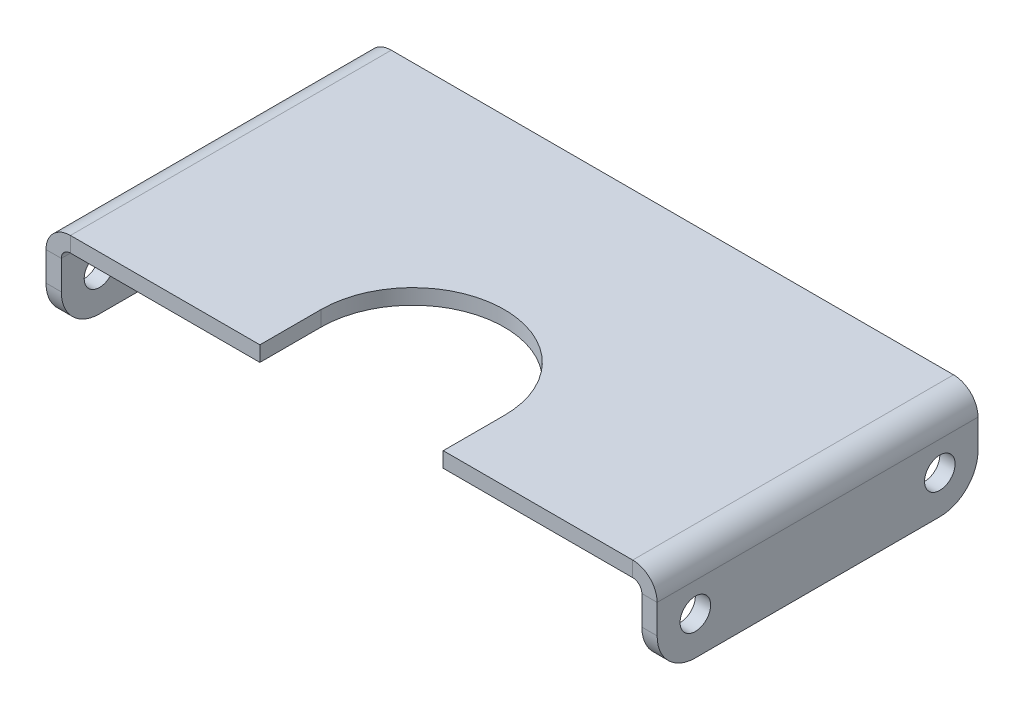
from build123d import *
from build123d.topology import SkipClean

# Parameters (mm, degrees)
EXTRUDE_THIN1_DEPTH        = 133.35
CUT_EXTRUDE1_DEPTH         = 189.050079766
SKETCH3_R                  = 6.35
CUT_EXTRUDE2_DEPTH         = 290.395633174
FILLET1_R                  = 15.875
CONVERT_SOLID1_START       = -123.9798384
CONVERT_SOLID1_OUTLINE_W   = 3.81
CONVERT_SOLID1_OUTLINE_H   = 133.35
CONVERT_SOLID1_DEPTH       = 85.8798384
CONVERT_SOLID1_START_2     = 38.1
CONVERT_SOLID1_2_OUTLINE_W = 3.81
CONVERT_SOLID1_2_OUTLINE_H = 133.35
CONVERT_SOLID1_2_DEPTH     = 85.8798384
CONVERT_SOLID1_START_3     = -124.46
CONVERT_SOLID1_3_OUTLINE_R = 6.35
CONVERT_SOLID1_3_DEPTH     = 3.81
CONVERT_SOLID1_START_4     = 120.65
CONVERT_SOLID1_4_OUTLINE_R = 6.35
CONVERT_SOLID1_4_DEPTH     = 3.81
CONVERT_SOLID1_5_OUTLINE_W = 76.2
CONVERT_SOLID1_5_OUTLINE_H = 6.35
CONVERT_SOLID1_5_DEPTH     = 13.700379
CONVERT_SOLID1_START_5     = 12.969621
CONVERT_SOLID1_6_DEPTH     = 120.380379
CONVERT_SOLID1_START_6     = -6.35
CONVERT_SOLID1_7_DEPTH     = 3.81
CONVERT_SOLID1_START_7     = -1
CONVERT_SOLID1_8_DEPTH     = 134.35


with BuildPart() as part:
    # Sketch1 → Extrude-Thin1 (new body)
    with BuildSketch(Plane.XY):
        Polygon((-127, -38.1), (-127, 0), (127, 0), (127, -38.1), (124.46, -38.1), (124.46, -2.54), (-124.46, -2.54), (-124.46, -38.1), align=None)
    extrude(amount=EXTRUDE_THIN1_DEPTH)

    # Sketch2 → Cut-Extrude1 (cut, through all)
    with BuildSketch(Plane(origin=(0, 0, 0), x_dir=(1, 0, 0), z_dir=(0, 1, 0))):
        with BuildLine():
            Line((38.1, -107.95), (38.1, -133.35))
            Line((38.1, -133.35), (-38.1, -133.35))
            Line((-38.1, -133.35), (-38.1, -107.95))
            ThreePointArc((-38.1, -107.95), (0, -69.85), (38.1, -107.95))
        make_face()
    extrude(amount=-CUT_EXTRUDE1_DEPTH, mode=Mode.SUBTRACT)

    # Sketch3 → Cut-Extrude2 (cut, through all)
    with BuildSketch(Plane.ZY.offset(127)):
        with Locations((15.875, -22.225)):
            Circle(SKETCH3_R)
        with Locations((117.475, -22.225)):
            Circle(SKETCH3_R)
    extrude(amount=-CUT_EXTRUDE2_DEPTH, mode=Mode.SUBTRACT)

    # Fillet1
    fillet1_edges = [part.edges().sort_by_distance(p)[0] for p in [
        (125.73, -38.1, 133.35),
        (125.73, -38.1, 0),
        (-125.73, -38.1, 133.35),
        (-125.73, -38.1, 0),
    ]]
    fillet(fillet1_edges, radius=FILLET1_R)

    # Convert-Solid1: read off the stored shape, not the designer's step
    # Convert-Solid1 outline → Convert-Solid1 (add)
    with BuildSketch(Plane.YZ.offset(CONVERT_SOLID1_START)):
        with Locations((-4.445, 66.675)):
            Rectangle(CONVERT_SOLID1_OUTLINE_W, CONVERT_SOLID1_OUTLINE_H)
    extrude(amount=CONVERT_SOLID1_DEPTH)

    # Convert-Solid1 2 outline → Convert-Solid1 2 (add)
    with BuildSketch(Plane.YZ.offset(CONVERT_SOLID1_START_2)):
        with Locations((-4.445, 66.675)):
            Rectangle(CONVERT_SOLID1_2_OUTLINE_W, CONVERT_SOLID1_2_OUTLINE_H)
    extrude(amount=CONVERT_SOLID1_2_DEPTH)

    # Convert-Solid1 3 outline → Convert-Solid1 3 (add)
    with SkipClean():  # the faces are left unmerged after this step: merging them gives an invalid solid
        with BuildSketch(Plane.YZ.offset(CONVERT_SOLID1_START_3)):
            with BuildLine():
                Line((-22.225, 0), (-6.35, 0))
                Line((-6.35, 0), (-6.35, 133.35))
                Line((-6.35, 133.35), (-22.225, 133.35))
                ThreePointArc((-22.225, 133.35), (-33.450320151, 128.700320151), (-38.1, 117.475))
                Line((-38.1, 117.475), (-38.1, 15.875))
                ThreePointArc((-38.1, 15.875), (-33.450320151, 4.649679849), (-22.225, 0))
            make_face()
            with Locations((-22.225, 15.875)):
                Circle(CONVERT_SOLID1_3_OUTLINE_R, mode=Mode.SUBTRACT)
            with Locations((-22.225, 117.475)):
                Circle(CONVERT_SOLID1_3_OUTLINE_R, mode=Mode.SUBTRACT)
        extrude(amount=CONVERT_SOLID1_3_DEPTH)

    # Convert-Solid1 4 outline → Convert-Solid1 4 (add)
    with SkipClean():  # the faces are left unmerged after this step: merging them gives an invalid solid
        with BuildSketch(Plane.YZ.offset(CONVERT_SOLID1_START_4)):
            with BuildLine():
                Line((-22.225, 0), (-6.35, 0))
                Line((-6.35, 0), (-6.35, 133.35))
                Line((-6.35, 133.35), (-22.225, 133.35))
                ThreePointArc((-22.225, 133.35), (-33.450320151, 128.700320151), (-38.1, 117.475))
                Line((-38.1, 117.475), (-38.1, 15.875))
                ThreePointArc((-38.1, 15.875), (-33.450320151, 4.649679849), (-22.225, 0))
            make_face()
            with Locations((-22.225, 15.875)):
                Circle(CONVERT_SOLID1_4_OUTLINE_R, mode=Mode.SUBTRACT)
            with Locations((-22.225, 117.475)):
                Circle(CONVERT_SOLID1_4_OUTLINE_R, mode=Mode.SUBTRACT)
        extrude(amount=CONVERT_SOLID1_4_DEPTH)

    # Convert-Solid1 5 outline → Convert-Solid1 5 (add)
    with SkipClean():  # the faces are left unmerged after this step: merging them gives an invalid solid
        with BuildSketch(Plane.XY):
            with BuildLine():
                Line((120.65, -6.35), (116.84, -6.35))
                ThreePointArc((116.84, -6.35), (119.534076836, -7.465923164), (120.65, -10.16))
                Line((120.65, -10.16), (120.65, -6.35))
            make_face()
            with BuildLine():
                ThreePointArc((-120.65, -10.16), (-119.534076836, -7.465923164), (-116.84, -6.35))
                Line((-116.84, -6.35), (-120.65, -6.35))
                Line((-120.65, -6.35), (-120.65, -10.16))
            make_face()
            with Locations((0, -3.175)):
                Rectangle(CONVERT_SOLID1_5_OUTLINE_W, CONVERT_SOLID1_5_OUTLINE_H)
            with BuildLine():
                ThreePointArc((124.46, -3.43979167), (124.224290518, -3.181615262), (123.9798384, -2.931700918))
                Line((123.9798384, -2.931700918), (123.9798384, -6.35))
                Line((123.9798384, -6.35), (124.46, -6.35))
                Line((124.46, -6.35), (124.46, -3.43979167))
            make_face()
            with BuildLine():
                Line((-123.9798384, -6.35), (-123.9798384, -2.931700918))
                ThreePointArc((-123.9798384, -2.931700918), (-124.224290518, -3.181615262), (-124.46, -3.43979167))
                Line((-124.46, -3.43979167), (-124.46, -6.35))
                Line((-124.46, -6.35), (-123.9798384, -6.35))
            make_face()
        extrude(amount=CONVERT_SOLID1_5_DEPTH)

    # Convert-Solid1 6 outline → Convert-Solid1 6 (add)
    with SkipClean():  # the faces are left unmerged after this step: merging them gives an invalid solid
        with BuildSketch(Plane.XY.offset(CONVERT_SOLID1_START_5)):
            with BuildLine():
                Line((120.65, -6.35), (116.84, -6.35))
                ThreePointArc((116.84, -6.35), (119.534076836, -7.465923164), (120.65, -10.16))
                Line((120.65, -10.16), (120.65, -6.35))
            make_face()
            with BuildLine():
                ThreePointArc((-120.65, -10.16), (-119.534076836, -7.465923164), (-116.84, -6.35))
                Line((-116.84, -6.35), (-120.65, -6.35))
                Line((-120.65, -6.35), (-120.65, -10.16))
            make_face()
            with BuildLine():
                ThreePointArc((124.46, -3.43979167), (124.224290518, -3.181615262), (123.9798384, -2.931700918))
                Line((123.9798384, -2.931700918), (123.9798384, -6.35))
                Line((123.9798384, -6.35), (124.46, -6.35))
                Line((124.46, -6.35), (124.46, -3.43979167))
            make_face()
            with BuildLine():
                Line((-123.9798384, -6.35), (-123.9798384, -2.931700918))
                ThreePointArc((-123.9798384, -2.931700918), (-124.224290518, -3.181615262), (-124.46, -3.43979167))
                Line((-124.46, -3.43979167), (-124.46, -6.35))
                Line((-124.46, -6.35), (-123.9798384, -6.35))
            make_face()
        extrude(amount=CONVERT_SOLID1_6_DEPTH)

    # Convert-Solid1 7 outline → Convert-Solid1 7 (add)
    with SkipClean():  # the faces are left unmerged after this step: merging them gives an invalid solid
        with BuildSketch(Plane(origin=(0, 0, 0), x_dir=(1, 0, 0), z_dir=(0, 1, 0)).offset(CONVERT_SOLID1_START_6)):
            with BuildLine():
                ThreePointArc((-38.1, -107.95), (0, -69.85), (38.1, -107.95))
                Line((38.1, -107.95), (38.1, 0))
                Line((38.1, 0), (-38.1, 0))
                Line((-38.1, 0), (-38.1, -107.95))
            make_face()
        extrude(amount=CONVERT_SOLID1_7_DEPTH)

    # Convert-Solid1 8 outline → Convert-Solid1 8 (cut)
    with SkipClean():  # the faces are left unmerged after this step: merging them gives an invalid solid
        with BuildSketch(Plane.XY.offset(CONVERT_SOLID1_START_7)):
            with BuildLine():
                Line((127, 0), (116.84, 0))
                ThreePointArc((116.84, 0), (120.699150251, -0.761459723), (123.9798384, -2.931700918))
                Line((123.9798384, -2.931700918), (123.9798384, -2.54))
                Line((123.9798384, -2.54), (124.46, -2.54))
                Line((124.46, -2.54), (124.46, -3.43979167))
                ThreePointArc((124.46, -3.43979167), (126.343809762, -6.567897551), (127, -10.16))
                Line((127, -10.16), (127, 0))
            make_face()
            with BuildLine():
                ThreePointArc((-123.9798384, -2.931700918), (-120.699150251, -0.761459723), (-116.84, 0))
                Line((-116.84, 0), (-127, 0))
                Line((-127, 0), (-127, -10.16))
                ThreePointArc((-127, -10.16), (-126.343809762, -6.567897551), (-124.46, -3.43979167))
                Line((-124.46, -3.43979167), (-124.46, -2.54))
                Line((-124.46, -2.54), (-123.9798384, -2.54))
                Line((-123.9798384, -2.54), (-123.9798384, -2.931700918))
            make_face()
        extrude(amount=CONVERT_SOLID1_8_DEPTH, mode=Mode.SUBTRACT)


solid = part.part
